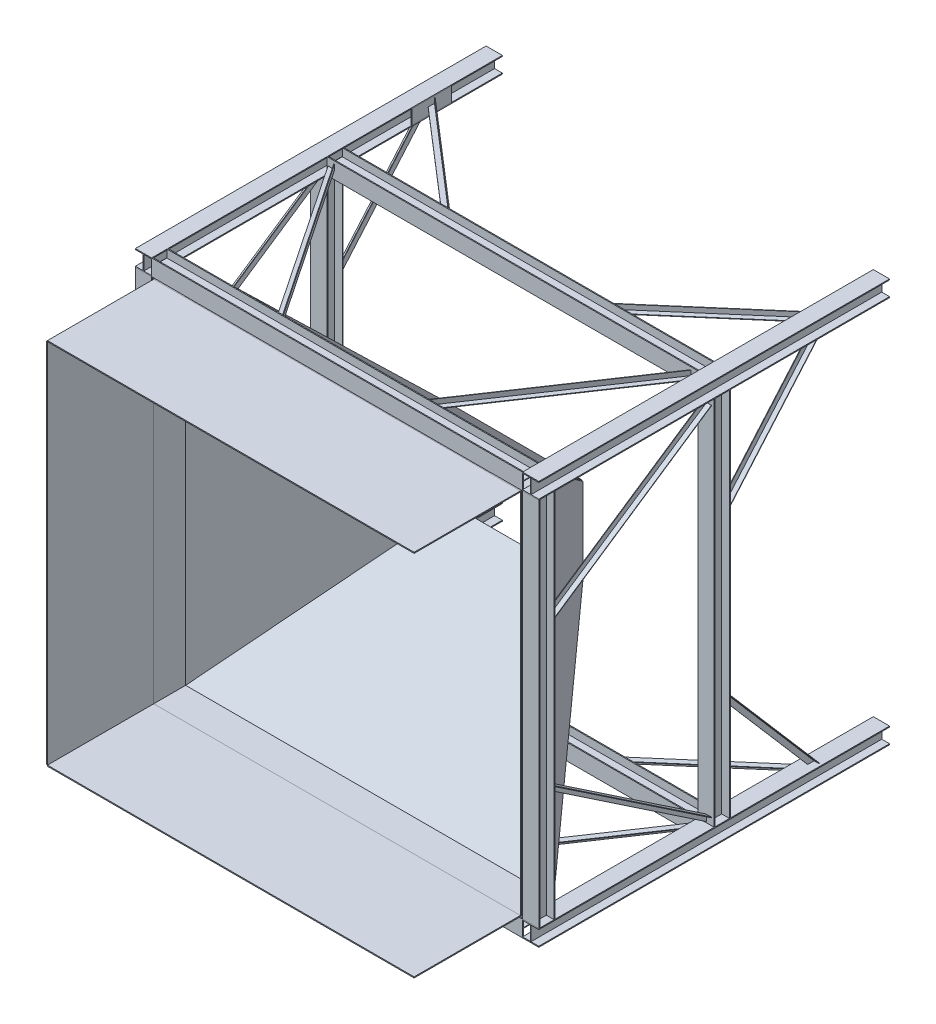
from build123d import *

# Parameters (mm, degrees)
COLUMNA_H_1_DEPTH                            = 3300
COLUMNA_H_2_DEPTH                            = 3300
COLUMNA_H_3_DEPTH                            = 3300
COLUMNA_H_4_DEPTH                            = 3300
VIGA_H_CARGA_1650_DEPTH                      = 3490
VIGA_H_CARGA_3300_DEPTH                      = 3490
CONTORNO_CIERRE_COLUMNA_CARGA_A_W            = 370
CONTORNO_CIERRE_COLUMNA_CARGA_A_H            = 135
CIERRE_COLUMNA_CARGA_A_DEPTH                 = 8
ALA_PLANA_ANGULAR_SUPERIOR_CARGA_A_DEPTH     = 5
RETORNO_ANGULAR_SUPERIOR_CARGA_A_DEPTH       = 45
ALA_PLANA_ANGULAR_INFERIOR_CARGA_A_DEPTH     = 5
RETORNO_ANGULAR_INFERIOR_CARGA_A_DEPTH       = 45
CONTORNO_CIERRE_COLUMNA_CARGA_B_W            = 370
CONTORNO_CIERRE_COLUMNA_CARGA_B_H            = 135
CIERRE_COLUMNA_CARGA_B_DEPTH                 = 8
ALA_PLANA_ANGULAR_SUPERIOR_CARGA_B_DEPTH     = 5
RETORNO_ANGULAR_SUPERIOR_CARGA_B_DEPTH       = 45
ALA_PLANA_ANGULAR_INFERIOR_CARGA_B_DEPTH     = 5
RETORNO_ANGULAR_INFERIOR_CARGA_B_DEPTH       = 45
CONTORNO_ASIENTO_SOLDADO_CARGA_W             = 2900
CONTORNO_ASIENTO_SOLDADO_CARGA_H             = 83.725
ASIENTO_SOLDADO_CARGA_DEPTH                  = 9.525
VIGA_H_FONDO_1650_DEPTH                      = 3490
VIGA_H_FONDO_3300_DEPTH                      = 3490
CONTORNO_CIERRE_COLUMNA_FONDO_A_W            = 370
CONTORNO_CIERRE_COLUMNA_FONDO_A_H            = 135
CIERRE_COLUMNA_FONDO_A_DEPTH                 = 8
ALA_PLANA_ANGULAR_SUPERIOR_FONDO_A_DEPTH     = 5
RETORNO_ANGULAR_SUPERIOR_FONDO_A_DEPTH       = 45
ALA_PLANA_ANGULAR_INFERIOR_FONDO_A_DEPTH     = 5
RETORNO_ANGULAR_INFERIOR_FONDO_A_DEPTH       = 45
CONTORNO_CIERRE_COLUMNA_FONDO_B_W            = 370
CONTORNO_CIERRE_COLUMNA_FONDO_B_H            = 135
CIERRE_COLUMNA_FONDO_B_DEPTH                 = 8
ALA_PLANA_ANGULAR_SUPERIOR_FONDO_B_DEPTH     = 5
RETORNO_ANGULAR_SUPERIOR_FONDO_B_DEPTH       = 45
ALA_PLANA_ANGULAR_INFERIOR_FONDO_B_DEPTH     = 5
RETORNO_ANGULAR_INFERIOR_FONDO_B_DEPTH       = 45
CONTORNO_ASIENTO_SOLDADO_FONDO_W             = 2900
CONTORNO_ASIENTO_SOLDADO_FONDO_H             = 83.725
ASIENTO_SOLDADO_FONDO_DEPTH                  = 9.525
VIGA_H_IZQUIERDA_1650_DEPTH                  = 3490
VIGA_H_IZQUIERDA_3300_DEPTH                  = 3490
ALA_PLANA_ANGULAR_SUPERIOR_IZQUIERDA_A_DEPTH = 5
RETORNO_ANGULAR_SUPERIOR_IZQUIERDA_A_DEPTH   = 45
ALA_PLANA_ANGULAR_INFERIOR_IZQUIERDA_A_DEPTH = 5
RETORNO_ANGULAR_INFERIOR_IZQUIERDA_A_DEPTH   = 45
ALA_PLANA_ANGULAR_SUPERIOR_IZQUIERDA_B_DEPTH = 5
RETORNO_ANGULAR_SUPERIOR_IZQUIERDA_B_DEPTH   = 45
ALA_PLANA_ANGULAR_INFERIOR_IZQUIERDA_B_DEPTH = 5
RETORNO_ANGULAR_INFERIOR_IZQUIERDA_B_DEPTH   = 45
CONTORNO_ASIENTO_SOLDADO_IZQUIERDA_W         = 83.725
CONTORNO_ASIENTO_SOLDADO_IZQUIERDA_H         = 2900
ASIENTO_SOLDADO_IZQUIERDA_DEPTH              = 9.525
VIGA_H_DERECHA_1650_DEPTH                    = 3490
VIGA_H_DERECHA_3300_DEPTH                    = 3490
ALA_PLANA_ANGULAR_SUPERIOR_DERECHA_A_DEPTH   = 5
RETORNO_ANGULAR_SUPERIOR_DERECHA_A_DEPTH     = 45
ALA_PLANA_ANGULAR_INFERIOR_DERECHA_A_DEPTH   = 5
RETORNO_ANGULAR_INFERIOR_DERECHA_A_DEPTH     = 45
ALA_PLANA_ANGULAR_SUPERIOR_DERECHA_B_DEPTH   = 5
RETORNO_ANGULAR_SUPERIOR_DERECHA_B_DEPTH     = 45
ALA_PLANA_ANGULAR_INFERIOR_DERECHA_B_DEPTH   = 5
RETORNO_ANGULAR_INFERIOR_DERECHA_B_DEPTH     = 45
CONTORNO_ASIENTO_SOLDADO_DERECHA_W           = 83.725
CONTORNO_ASIENTO_SOLDADO_DERECHA_H           = 2900
ASIENTO_SOLDADO_DERECHA_DEPTH                = 9.525
CONTORNO_COLLAR_LATERAL_Y_NEGATIVO_W         = 3450
CONTORNO_COLLAR_LATERAL_Y_NEGATIVO_H         = 300
COLLAR_LATERAL_Y_NEGATIVO_DEPTH              = 9.525
CONTORNO_ALER_N_LATERAL_Y_NEGATIVO_W         = 3450
CONTORNO_ALER_N_LATERAL_Y_NEGATIVO_H         = 1000
ALER_N_LATERAL_Y_NEGATIVO_DEPTH              = 9.525
EMBUDO_LATERAL_Y_NEGATIVO_DEPTH              = 9.525
CONTORNO_COLLAR_CARGA_W                      = 300
CONTORNO_COLLAR_CARGA_H                      = 3450
COLLAR_CARGA_DEPTH                           = 9.525
EMBUDO_CARGA_DEPTH                           = 9.525
CONTORNO_COLLAR_LATERAL_Y_POSITIVO_W         = 3450
CONTORNO_COLLAR_LATERAL_Y_POSITIVO_H         = 300
COLLAR_LATERAL_Y_POSITIVO_DEPTH              = 9.525
CONTORNO_ALER_N_LATERAL_Y_POSITIVO_W         = 3450
CONTORNO_ALER_N_LATERAL_Y_POSITIVO_H         = 1000
ALER_N_LATERAL_Y_POSITIVO_DEPTH              = 9.525
EMBUDO_LATERAL_Y_POSITIVO_DEPTH              = 9.525
CONTORNO_COLLAR_FONDO_X_NEGATIVO_W           = 300
CONTORNO_COLLAR_FONDO_X_NEGATIVO_H           = 3450
COLLAR_FONDO_X_NEGATIVO_DEPTH                = 9.525
CONTORNO_ALER_N_FONDO_X_NEGATIVO_W           = 1000
CONTORNO_ALER_N_FONDO_X_NEGATIVO_H           = 3450
ALER_N_FONDO_X_NEGATIVO_DEPTH                = 9.525
EMBUDO_FONDO_X_NEGATIVO_DEPTH                = 9.525


with BuildPart() as part:
    # Contorno Columna H 1 → Columna H 1 (new body)
    with BuildSketch(Plane.XY):
        Polygon((-1898, -1898), (-1745, -1898), (-1745, -1889), (-1818.25, -1889), (-1818.25, -1754), (-1745, -1754), (-1745, -1745), (-1898, -1745), (-1898, -1754), (-1824.75, -1754), (-1824.75, -1889), (-1898, -1889), align=None)
    extrude(amount=COLUMNA_H_1_DEPTH)


with BuildPart() as body_2:
    # Contorno Columna H 2 → Columna H 2 (new body)
    with BuildSketch(Plane.XY):
        Polygon((-1898, 1745), (-1745, 1745), (-1745, 1754), (-1818.25, 1754), (-1818.25, 1889), (-1745, 1889), (-1745, 1898), (-1898, 1898), (-1898, 1889), (-1824.75, 1889), (-1824.75, 1754), (-1898, 1754), align=None)
    extrude(amount=COLUMNA_H_2_DEPTH)


with BuildPart() as body_3:
    # Contorno Columna H 3 → Columna H 3 (new body)
    with BuildSketch(Plane.XY):
        Polygon((1745, -1898), (1898, -1898), (1898, -1889), (1824.75, -1889), (1824.75, -1754), (1898, -1754), (1898, -1745), (1745, -1745), (1745, -1754), (1818.25, -1754), (1818.25, -1889), (1745, -1889), align=None)
    extrude(amount=COLUMNA_H_3_DEPTH)


with BuildPart() as body_4:
    # Contorno Columna H 4 → Columna H 4 (new body)
    with BuildSketch(Plane.XY):
        Polygon((1745, 1745), (1898, 1745), (1898, 1754), (1824.75, 1754), (1824.75, 1889), (1898, 1889), (1898, 1898), (1745, 1898), (1745, 1889), (1818.25, 1889), (1818.25, 1754), (1745, 1754), align=None)
    extrude(amount=COLUMNA_H_4_DEPTH)


with BuildPart() as body_5:
    # Contorno Viga H carga 1650 → Viga H carga 1650 (new body)
    with BuildSketch(Plane(origin=(-1745, 0, 0), x_dir=(0, 0, -1), z_dir=(1, 0, 0))):
        Polygon((-1497, -1745), (-1497, -1898), (-1506, -1898), (-1506, -1824.75), (-1641, -1824.75), (-1641, -1898), (-1650, -1898), (-1650, -1745), (-1641, -1745), (-1641, -1818.25), (-1506, -1818.25), (-1506, -1745), align=None)
    extrude(amount=VIGA_H_CARGA_1650_DEPTH)


with BuildPart() as body_6:
    # Contorno Viga H carga 3300 → Viga H carga 3300 (new body)
    with BuildSketch(Plane(origin=(-1745, 0, 0), x_dir=(0, 0, -1), z_dir=(1, 0, 0))):
        Polygon((-3147, -1745), (-3147, -1898), (-3156, -1898), (-3156, -1824.75), (-3291, -1824.75), (-3291, -1898), (-3300, -1898), (-3300, -1745), (-3291, -1745), (-3291, -1818.25), (-3156, -1818.25), (-3156, -1745), align=None)
    extrude(amount=VIGA_H_CARGA_3300_DEPTH)


with BuildPart() as body_7:
    # Contorno Cierre columna carga A → Cierre columna carga A (new body)
    with BuildSketch(Plane(origin=(-1745, 0, 0), x_dir=(0, 0, -1), z_dir=(1, 0, 0))):
        with Locations((-665, -1821.5)):
            Rectangle(CONTORNO_CIERRE_COLUMNA_CARGA_A_W, CONTORNO_CIERRE_COLUMNA_CARGA_A_H)
    extrude(amount=-CIERRE_COLUMNA_CARGA_A_DEPTH)


with BuildPart() as body_8:
    # Contorno Ala plana Angular superior carg → Ala plana Angular superior carga A (new body)
    with BuildSketch(Plane(origin=(0, -1821.5, 0), x_dir=(1, 0, 0), z_dir=(0, 1, 0))):
        Polygon((-1674.870108064, -1650), (-1735.129891936, -1650), (-728.129891936, -3147), (-667.870108064, -3147), align=None)
    extrude(amount=-ALA_PLANA_ANGULAR_SUPERIOR_CARGA_A_DEPTH)


with BuildPart() as body_9:
    # Contorno Retorno Angular superior carga → Retorno Angular superior carga A (new body)
    with BuildSketch(Plane(origin=(0, -1826.5, 0), x_dir=(1, 0, 0), z_dir=(0, 1, 0))):
        Polygon((-1674.870108064, -1650), (-1680.896086451, -1650), (-673.896086451, -3147), (-667.870108064, -3147), align=None)
    extrude(amount=-RETORNO_ANGULAR_SUPERIOR_CARGA_A_DEPTH)


with BuildPart() as body_8_1:
    add(body_8.part)

    # Angular superior carga A: union body 9
    add(body_9.part)


with BuildPart() as body_9_2:
    # Contorno Ala plana Angular inferior carg → Ala plana Angular inferior carga A (new body)
    with BuildSketch(Plane(origin=(0, -1821.5, 0), x_dir=(1, 0, 0), z_dir=(0, 1, 0))):
        Polygon((-1745, -631.991026401), (-1745, -698.008973599), (-818.285648465, -1497), (-741.714351535, -1497), align=None)
    extrude(amount=-ALA_PLANA_ANGULAR_INFERIOR_CARGA_A_DEPTH)


with BuildPart() as body_10:
    # Contorno Retorno Angular inferior carga → Retorno Angular inferior carga A (new body)
    with BuildSketch(Plane(origin=(0, -1826.5, 0), x_dir=(1, 0, 0), z_dir=(0, 1, 0))):
        Polygon((-1745, -631.991026401), (-1745, -638.592821121), (-749.371481228, -1497), (-741.714351535, -1497), align=None)
    extrude(amount=-RETORNO_ANGULAR_INFERIOR_CARGA_A_DEPTH)


with BuildPart() as body_9_2_1:
    add(body_9_2.part)

    # Angular inferior carga A: union body 10
    add(body_10.part)


with BuildPart() as body_10_2:
    # Contorno Cierre columna carga B → Cierre columna carga B (new body)
    with BuildSketch(Plane(origin=(1745, 0, 0), x_dir=(0, 0, -1), z_dir=(1, 0, 0))):
        with Locations((-665, -1821.5)):
            Rectangle(CONTORNO_CIERRE_COLUMNA_CARGA_B_W, CONTORNO_CIERRE_COLUMNA_CARGA_B_H)
    extrude(amount=CIERRE_COLUMNA_CARGA_B_DEPTH)


with BuildPart() as body_11:
    # Contorno Ala plana Angular superior  2 → Ala plana Angular superior carga B (new body)
    with BuildSketch(Plane(origin=(0, -1821.5, 0), x_dir=(1, 0, 0), z_dir=(0, 1, 0))):
        Polygon((1674.870108064, -1650), (1735.129891936, -1650), (728.129891936, -3147), (667.870108064, -3147), align=None)
    extrude(amount=-ALA_PLANA_ANGULAR_SUPERIOR_CARGA_B_DEPTH)


with BuildPart() as body_12:
    # Contorno Retorno Angular superior ca 2 → Retorno Angular superior carga B (new body)
    with BuildSketch(Plane(origin=(0, -1826.5, 0), x_dir=(1, 0, 0), z_dir=(0, 1, 0))):
        Polygon((1674.870108064, -1650), (1680.896086451, -1650), (673.896086451, -3147), (667.870108064, -3147), align=None)
    extrude(amount=-RETORNO_ANGULAR_SUPERIOR_CARGA_B_DEPTH)


with BuildPart() as body_11_1:
    add(body_11.part)

    # Angular superior carga B: union body 12
    add(body_12.part)


with BuildPart() as body_12_2:
    # Contorno Ala plana Angular inferior  2 → Ala plana Angular inferior carga B (new body)
    with BuildSketch(Plane(origin=(0, -1821.5, 0), x_dir=(1, 0, 0), z_dir=(0, 1, 0))):
        Polygon((1745, -631.991026401), (1745, -698.008973599), (818.285648465, -1497), (741.714351535, -1497), align=None)
    extrude(amount=-ALA_PLANA_ANGULAR_INFERIOR_CARGA_B_DEPTH)


with BuildPart() as body_13:
    # Contorno Retorno Angular inferior ca 2 → Retorno Angular inferior carga B (new body)
    with BuildSketch(Plane(origin=(0, -1826.5, 0), x_dir=(1, 0, 0), z_dir=(0, 1, 0))):
        Polygon((1745, -631.991026401), (1745, -638.592821121), (749.371481228, -1497), (741.714351535, -1497), align=None)
    extrude(amount=-RETORNO_ANGULAR_INFERIOR_CARGA_B_DEPTH)


with BuildPart() as body_12_2_1:
    add(body_12_2.part)

    # Angular inferior carga B: union body 13
    add(body_13.part)


with BuildPart() as body_13_2:
    # Contorno Asiento soldado carga → Asiento soldado carga (new body)
    with BuildSketch(Plane.XY.offset(3281.475)):
        with Locations((0, -1776.3875)):
            Rectangle(CONTORNO_ASIENTO_SOLDADO_CARGA_W, CONTORNO_ASIENTO_SOLDADO_CARGA_H)
    extrude(amount=ASIENTO_SOLDADO_CARGA_DEPTH)


with BuildPart() as body_14:
    # Contorno Viga H fondo 1650 → Viga H fondo 1650 (new body)
    with BuildSketch(Plane(origin=(-1745, 0, 0), x_dir=(0, 0, -1), z_dir=(1, 0, 0))):
        Polygon((-1497, 1745), (-1497, 1898), (-1506, 1898), (-1506, 1824.75), (-1641, 1824.75), (-1641, 1898), (-1650, 1898), (-1650, 1745), (-1641, 1745), (-1641, 1818.25), (-1506, 1818.25), (-1506, 1745), align=None)
    extrude(amount=VIGA_H_FONDO_1650_DEPTH)


with BuildPart() as body_15:
    # Contorno Viga H fondo 3300 → Viga H fondo 3300 (new body)
    with BuildSketch(Plane(origin=(-1745, 0, 0), x_dir=(0, 0, -1), z_dir=(1, 0, 0))):
        Polygon((-3147, 1745), (-3147, 1898), (-3156, 1898), (-3156, 1824.75), (-3291, 1824.75), (-3291, 1898), (-3300, 1898), (-3300, 1745), (-3291, 1745), (-3291, 1818.25), (-3156, 1818.25), (-3156, 1745), align=None)
    extrude(amount=VIGA_H_FONDO_3300_DEPTH)


with BuildPart() as body_16:
    # Contorno Cierre columna fondo A → Cierre columna fondo A (new body)
    with BuildSketch(Plane(origin=(-1745, 0, 0), x_dir=(0, 0, -1), z_dir=(1, 0, 0))):
        with Locations((-665, 1821.5)):
            Rectangle(CONTORNO_CIERRE_COLUMNA_FONDO_A_W, CONTORNO_CIERRE_COLUMNA_FONDO_A_H)
    extrude(amount=-CIERRE_COLUMNA_FONDO_A_DEPTH)


with BuildPart() as body_17:
    # Contorno Ala plana Angular superior fond → Ala plana Angular superior fondo A (new body)
    with BuildSketch(Plane(origin=(0, 1821.5, 0), x_dir=(1, 0, 0), z_dir=(0, 1, 0))):
        Polygon((-1674.870108064, -1650), (-1735.129891936, -1650), (-728.129891936, -3147), (-667.870108064, -3147), align=None)
    extrude(amount=ALA_PLANA_ANGULAR_SUPERIOR_FONDO_A_DEPTH)


with BuildPart() as body_18:
    # Contorno Retorno Angular superior fondo → Retorno Angular superior fondo A (new body)
    with BuildSketch(Plane(origin=(0, 1826.5, 0), x_dir=(1, 0, 0), z_dir=(0, 1, 0))):
        Polygon((-1674.870108064, -1650), (-1680.896086451, -1650), (-673.896086451, -3147), (-667.870108064, -3147), align=None)
    extrude(amount=RETORNO_ANGULAR_SUPERIOR_FONDO_A_DEPTH)


with BuildPart() as body_17_1:
    add(body_17.part)

    # Angular superior fondo A: union body 18
    add(body_18.part)


with BuildPart() as body_18_2:
    # Contorno Ala plana Angular inferior fond → Ala plana Angular inferior fondo A (new body)
    with BuildSketch(Plane(origin=(0, 1821.5, 0), x_dir=(1, 0, 0), z_dir=(0, 1, 0))):
        Polygon((-1745, -631.991026401), (-1745, -698.008973599), (-818.285648465, -1497), (-741.714351535, -1497), align=None)
    extrude(amount=ALA_PLANA_ANGULAR_INFERIOR_FONDO_A_DEPTH)


with BuildPart() as body_19:
    # Contorno Retorno Angular inferior fondo → Retorno Angular inferior fondo A (new body)
    with BuildSketch(Plane(origin=(0, 1826.5, 0), x_dir=(1, 0, 0), z_dir=(0, 1, 0))):
        Polygon((-1745, -631.991026401), (-1745, -638.592821121), (-749.371481228, -1497), (-741.714351535, -1497), align=None)
    extrude(amount=RETORNO_ANGULAR_INFERIOR_FONDO_A_DEPTH)


with BuildPart() as body_18_2_1:
    add(body_18_2.part)

    # Angular inferior fondo A: union body 19
    add(body_19.part)


with BuildPart() as body_19_2:
    # Contorno Cierre columna fondo B → Cierre columna fondo B (new body)
    with BuildSketch(Plane(origin=(1745, 0, 0), x_dir=(0, 0, -1), z_dir=(1, 0, 0))):
        with Locations((-665, 1821.5)):
            Rectangle(CONTORNO_CIERRE_COLUMNA_FONDO_B_W, CONTORNO_CIERRE_COLUMNA_FONDO_B_H)
    extrude(amount=CIERRE_COLUMNA_FONDO_B_DEPTH)


with BuildPart() as body_20:
    # Contorno Ala plana Angular superior  3 → Ala plana Angular superior fondo B (new body)
    with BuildSketch(Plane(origin=(0, 1821.5, 0), x_dir=(1, 0, 0), z_dir=(0, 1, 0))):
        Polygon((1674.870108064, -1650), (1735.129891936, -1650), (728.129891936, -3147), (667.870108064, -3147), align=None)
    extrude(amount=ALA_PLANA_ANGULAR_SUPERIOR_FONDO_B_DEPTH)


with BuildPart() as body_21:
    # Contorno Retorno Angular superior fo 2 → Retorno Angular superior fondo B (new body)
    with BuildSketch(Plane(origin=(0, 1826.5, 0), x_dir=(1, 0, 0), z_dir=(0, 1, 0))):
        Polygon((1674.870108064, -1650), (1680.896086451, -1650), (673.896086451, -3147), (667.870108064, -3147), align=None)
    extrude(amount=RETORNO_ANGULAR_SUPERIOR_FONDO_B_DEPTH)


with BuildPart() as body_20_1:
    add(body_20.part)

    # Angular superior fondo B: union body 21
    add(body_21.part)


with BuildPart() as body_21_2:
    # Contorno Ala plana Angular inferior  3 → Ala plana Angular inferior fondo B (new body)
    with BuildSketch(Plane(origin=(0, 1821.5, 0), x_dir=(1, 0, 0), z_dir=(0, 1, 0))):
        Polygon((1745, -631.991026401), (1745, -698.008973599), (818.285648465, -1497), (741.714351535, -1497), align=None)
    extrude(amount=ALA_PLANA_ANGULAR_INFERIOR_FONDO_B_DEPTH)


with BuildPart() as body_22:
    # Contorno Retorno Angular inferior fo 2 → Retorno Angular inferior fondo B (new body)
    with BuildSketch(Plane(origin=(0, 1826.5, 0), x_dir=(1, 0, 0), z_dir=(0, 1, 0))):
        Polygon((1745, -631.991026401), (1745, -638.592821121), (749.371481228, -1497), (741.714351535, -1497), align=None)
    extrude(amount=RETORNO_ANGULAR_INFERIOR_FONDO_B_DEPTH)


with BuildPart() as body_21_2_1:
    add(body_21_2.part)

    # Angular inferior fondo B: union body 22
    add(body_22.part)


with BuildPart() as body_22_2:
    # Contorno Asiento soldado fondo → Asiento soldado fondo (new body)
    with BuildSketch(Plane.XY.offset(3281.475)):
        with Locations((0, 1776.3875)):
            Rectangle(CONTORNO_ASIENTO_SOLDADO_FONDO_W, CONTORNO_ASIENTO_SOLDADO_FONDO_H)
    extrude(amount=ASIENTO_SOLDADO_FONDO_DEPTH)


with BuildPart() as body_23:
    # Contorno Viga H izquierda 1650 → Viga H izquierda 1650 (new body)
    with BuildSketch(Plane(origin=(0, -1745, 0), x_dir=(1, 0, 0), z_dir=(0, 1, 0))):
        Polygon((-1745, -1497), (-1898, -1497), (-1898, -1506), (-1824.75, -1506), (-1824.75, -1641), (-1898, -1641), (-1898, -1650), (-1745, -1650), (-1745, -1641), (-1818.25, -1641), (-1818.25, -1506), (-1745, -1506), align=None)
    extrude(amount=VIGA_H_IZQUIERDA_1650_DEPTH)


with BuildPart() as body_24:
    # Contorno Viga H izquierda 3300 → Viga H izquierda 3300 (new body)
    with BuildSketch(Plane(origin=(0, -1745, 0), x_dir=(1, 0, 0), z_dir=(0, 1, 0))):
        Polygon((-1745, -3147), (-1898, -3147), (-1898, -3156), (-1824.75, -3156), (-1824.75, -3291), (-1898, -3291), (-1898, -3300), (-1745, -3300), (-1745, -3291), (-1818.25, -3291), (-1818.25, -3156), (-1745, -3156), align=None)
    extrude(amount=VIGA_H_IZQUIERDA_3300_DEPTH)


with BuildPart() as body_25:
    # Contorno Ala plana Angular superior izqu → Ala plana Angular superior izquierda A (new body)
    with BuildSketch(Plane(origin=(-1821.5, 0, 0), x_dir=(0, 0, -1), z_dir=(1, 0, 0))):
        Polygon((-1650, -1674.870108064), (-1650, -1735.129891936), (-3147, -728.129891936), (-3147, -667.870108064), align=None)
    extrude(amount=-ALA_PLANA_ANGULAR_SUPERIOR_IZQUIERDA_A_DEPTH)


with BuildPart() as body_26:
    # Contorno Retorno Angular superior izquie → Retorno Angular superior izquierda A (new body)
    with BuildSketch(Plane(origin=(-1826.5, 0, 0), x_dir=(0, 0, -1), z_dir=(1, 0, 0))):
        Polygon((-1650, -1674.870108064), (-1650, -1680.896086451), (-3147, -673.896086451), (-3147, -667.870108064), align=None)
    extrude(amount=-RETORNO_ANGULAR_SUPERIOR_IZQUIERDA_A_DEPTH)


with BuildPart() as body_25_1:
    add(body_25.part)

    # Angular superior izquierda A: union body 26
    add(body_26.part)


with BuildPart() as body_26_2:
    # Contorno Ala plana Angular inferior izqu → Ala plana Angular inferior izquierda A (new body)
    with BuildSketch(Plane(origin=(-1821.5, 0, 0), x_dir=(0, 0, -1), z_dir=(1, 0, 0))):
        Polygon((-631.991026401, -1745), (-698.008973599, -1745), (-1497, -818.285648465), (-1497, -741.714351535), align=None)
    extrude(amount=-ALA_PLANA_ANGULAR_INFERIOR_IZQUIERDA_A_DEPTH)


with BuildPart() as body_27:
    # Contorno Retorno Angular inferior izquie → Retorno Angular inferior izquierda A (new body)
    with BuildSketch(Plane(origin=(-1826.5, 0, 0), x_dir=(0, 0, -1), z_dir=(1, 0, 0))):
        Polygon((-631.991026401, -1745), (-638.592821121, -1745), (-1497, -749.371481228), (-1497, -741.714351535), align=None)
    extrude(amount=-RETORNO_ANGULAR_INFERIOR_IZQUIERDA_A_DEPTH)


with BuildPart() as body_26_2_1:
    add(body_26_2.part)

    # Angular inferior izquierda A: union body 27
    add(body_27.part)


with BuildPart() as body_27_2:
    # Contorno Ala plana Angular superior  4 → Ala plana Angular superior izquierda B (new body)
    with BuildSketch(Plane(origin=(-1821.5, 0, 0), x_dir=(0, 0, -1), z_dir=(1, 0, 0))):
        Polygon((-1650, 1674.870108064), (-1650, 1735.129891936), (-3147, 728.129891936), (-3147, 667.870108064), align=None)
    extrude(amount=-ALA_PLANA_ANGULAR_SUPERIOR_IZQUIERDA_B_DEPTH)


with BuildPart() as body_28:
    # Contorno Retorno Angular superior iz 2 → Retorno Angular superior izquierda B (new body)
    with BuildSketch(Plane(origin=(-1826.5, 0, 0), x_dir=(0, 0, -1), z_dir=(1, 0, 0))):
        Polygon((-1650, 1674.870108064), (-1650, 1680.896086451), (-3147, 673.896086451), (-3147, 667.870108064), align=None)
    extrude(amount=-RETORNO_ANGULAR_SUPERIOR_IZQUIERDA_B_DEPTH)


with BuildPart() as body_27_2_1:
    add(body_27_2.part)

    # Angular superior izquierda B: union body 28
    add(body_28.part)


with BuildPart() as body_28_2:
    # Contorno Ala plana Angular inferior  4 → Ala plana Angular inferior izquierda B (new body)
    with BuildSketch(Plane(origin=(-1821.5, 0, 0), x_dir=(0, 0, -1), z_dir=(1, 0, 0))):
        Polygon((-631.991026401, 1745), (-698.008973599, 1745), (-1497, 818.285648465), (-1497, 741.714351535), align=None)
    extrude(amount=-ALA_PLANA_ANGULAR_INFERIOR_IZQUIERDA_B_DEPTH)


with BuildPart() as body_29:
    # Contorno Retorno Angular inferior iz 2 → Retorno Angular inferior izquierda B (new body)
    with BuildSketch(Plane(origin=(-1826.5, 0, 0), x_dir=(0, 0, -1), z_dir=(1, 0, 0))):
        Polygon((-631.991026401, 1745), (-638.592821121, 1745), (-1497, 749.371481228), (-1497, 741.714351535), align=None)
    extrude(amount=-RETORNO_ANGULAR_INFERIOR_IZQUIERDA_B_DEPTH)


with BuildPart() as body_28_2_1:
    add(body_28_2.part)

    # Angular inferior izquierda B: union body 29
    add(body_29.part)


with BuildPart() as body_29_2:
    # Contorno Asiento soldado izquierda → Asiento soldado izquierda (new body)
    with BuildSketch(Plane.XY.offset(3281.475)):
        with Locations((-1776.3875, 0)):
            Rectangle(CONTORNO_ASIENTO_SOLDADO_IZQUIERDA_W, CONTORNO_ASIENTO_SOLDADO_IZQUIERDA_H)
    extrude(amount=ASIENTO_SOLDADO_IZQUIERDA_DEPTH)


with BuildPart() as body_30:
    # Contorno Viga H derecha 1650 → Viga H derecha 1650 (new body)
    with BuildSketch(Plane(origin=(0, -1745, 0), x_dir=(1, 0, 0), z_dir=(0, 1, 0))):
        Polygon((1745, -1497), (1898, -1497), (1898, -1506), (1824.75, -1506), (1824.75, -1641), (1898, -1641), (1898, -1650), (1745, -1650), (1745, -1641), (1818.25, -1641), (1818.25, -1506), (1745, -1506), align=None)
    extrude(amount=VIGA_H_DERECHA_1650_DEPTH)


with BuildPart() as body_31:
    # Contorno Viga H derecha 3300 → Viga H derecha 3300 (new body)
    with BuildSketch(Plane(origin=(0, -1745, 0), x_dir=(1, 0, 0), z_dir=(0, 1, 0))):
        Polygon((1745, -3147), (1898, -3147), (1898, -3156), (1824.75, -3156), (1824.75, -3291), (1898, -3291), (1898, -3300), (1745, -3300), (1745, -3291), (1818.25, -3291), (1818.25, -3156), (1745, -3156), align=None)
    extrude(amount=VIGA_H_DERECHA_3300_DEPTH)


with BuildPart() as body_32:
    # Contorno Ala plana Angular superior dere → Ala plana Angular superior derecha A (new body)
    with BuildSketch(Plane(origin=(1821.5, 0, 0), x_dir=(0, 0, -1), z_dir=(1, 0, 0))):
        Polygon((-1650, -1674.870108064), (-1650, -1735.129891936), (-3147, -728.129891936), (-3147, -667.870108064), align=None)
    extrude(amount=ALA_PLANA_ANGULAR_SUPERIOR_DERECHA_A_DEPTH)


with BuildPart() as body_33:
    # Contorno Retorno Angular superior derech → Retorno Angular superior derecha A (new body)
    with BuildSketch(Plane(origin=(1826.5, 0, 0), x_dir=(0, 0, -1), z_dir=(1, 0, 0))):
        Polygon((-1650, -1674.870108064), (-1650, -1680.896086451), (-3147, -673.896086451), (-3147, -667.870108064), align=None)
    extrude(amount=RETORNO_ANGULAR_SUPERIOR_DERECHA_A_DEPTH)


with BuildPart() as body_32_1:
    add(body_32.part)

    # Angular superior derecha A: union body 33
    add(body_33.part)


with BuildPart() as body_33_2:
    # Contorno Ala plana Angular inferior dere → Ala plana Angular inferior derecha A (new body)
    with BuildSketch(Plane(origin=(1821.5, 0, 0), x_dir=(0, 0, -1), z_dir=(1, 0, 0))):
        Polygon((-631.991026401, -1745), (-698.008973599, -1745), (-1497, -818.285648465), (-1497, -741.714351535), align=None)
    extrude(amount=ALA_PLANA_ANGULAR_INFERIOR_DERECHA_A_DEPTH)


with BuildPart() as body_34:
    # Contorno Retorno Angular inferior derech → Retorno Angular inferior derecha A (new body)
    with BuildSketch(Plane(origin=(1826.5, 0, 0), x_dir=(0, 0, -1), z_dir=(1, 0, 0))):
        Polygon((-631.991026401, -1745), (-638.592821121, -1745), (-1497, -749.371481228), (-1497, -741.714351535), align=None)
    extrude(amount=RETORNO_ANGULAR_INFERIOR_DERECHA_A_DEPTH)


with BuildPart() as body_33_2_1:
    add(body_33_2.part)

    # Angular inferior derecha A: union body 34
    add(body_34.part)


with BuildPart() as body_34_2:
    # Contorno Ala plana Angular superior  5 → Ala plana Angular superior derecha B (new body)
    with BuildSketch(Plane(origin=(1821.5, 0, 0), x_dir=(0, 0, -1), z_dir=(1, 0, 0))):
        Polygon((-1650, 1674.870108064), (-1650, 1735.129891936), (-3147, 728.129891936), (-3147, 667.870108064), align=None)
    extrude(amount=ALA_PLANA_ANGULAR_SUPERIOR_DERECHA_B_DEPTH)


with BuildPart() as body_35:
    # Contorno Retorno Angular superior de 2 → Retorno Angular superior derecha B (new body)
    with BuildSketch(Plane(origin=(1826.5, 0, 0), x_dir=(0, 0, -1), z_dir=(1, 0, 0))):
        Polygon((-1650, 1674.870108064), (-1650, 1680.896086451), (-3147, 673.896086451), (-3147, 667.870108064), align=None)
    extrude(amount=RETORNO_ANGULAR_SUPERIOR_DERECHA_B_DEPTH)


with BuildPart() as body_34_2_1:
    add(body_34_2.part)

    # Angular superior derecha B: union body 35
    add(body_35.part)


with BuildPart() as body_35_2:
    # Contorno Ala plana Angular inferior  5 → Ala plana Angular inferior derecha B (new body)
    with BuildSketch(Plane(origin=(1821.5, 0, 0), x_dir=(0, 0, -1), z_dir=(1, 0, 0))):
        Polygon((-631.991026401, 1745), (-698.008973599, 1745), (-1497, 818.285648465), (-1497, 741.714351535), align=None)
    extrude(amount=ALA_PLANA_ANGULAR_INFERIOR_DERECHA_B_DEPTH)


with BuildPart() as body_36:
    # Contorno Retorno Angular inferior de 2 → Retorno Angular inferior derecha B (new body)
    with BuildSketch(Plane(origin=(1826.5, 0, 0), x_dir=(0, 0, -1), z_dir=(1, 0, 0))):
        Polygon((-631.991026401, 1745), (-638.592821121, 1745), (-1497, 749.371481228), (-1497, 741.714351535), align=None)
    extrude(amount=RETORNO_ANGULAR_INFERIOR_DERECHA_B_DEPTH)


with BuildPart() as body_35_2_1:
    add(body_35_2.part)

    # Angular inferior derecha B: union body 36
    add(body_36.part)


with BuildPart() as body_36_2:
    # Contorno Asiento soldado derecha → Asiento soldado derecha (new body)
    with BuildSketch(Plane.XY.offset(3281.475)):
        with Locations((1776.3875, 0)):
            Rectangle(CONTORNO_ASIENTO_SOLDADO_DERECHA_W, CONTORNO_ASIENTO_SOLDADO_DERECHA_H)
    extrude(amount=ASIENTO_SOLDADO_DERECHA_DEPTH)


with BuildPart() as body_37:
    # Contorno Collar lateral Y negativo → Collar lateral Y negativo (new body)
    with BuildSketch(Plane(origin=(0, -1725, 0), x_dir=(1, 0, 0), z_dir=(0, 1, 0))):
        with Locations((0, -3150)):
            Rectangle(CONTORNO_COLLAR_LATERAL_Y_NEGATIVO_W, CONTORNO_COLLAR_LATERAL_Y_NEGATIVO_H)
    extrude(amount=-COLLAR_LATERAL_Y_NEGATIVO_DEPTH)


with BuildPart() as body_38:
    # Contorno Alerón lateral Y negativo → Alerón lateral Y negativo (new body)
    with BuildSketch(Plane(origin=(0, -1725, 0), x_dir=(1, 0, 0), z_dir=(0, 1, 0))):
        with Locations((0, -3800)):
            Rectangle(CONTORNO_ALER_N_LATERAL_Y_NEGATIVO_W, CONTORNO_ALER_N_LATERAL_Y_NEGATIVO_H)
    extrude(amount=-ALER_N_LATERAL_Y_NEGATIVO_DEPTH)


with BuildPart() as body_39:
    # Contorno Embudo lateral Y negativo → Embudo lateral Y negativo (new body)
    with BuildSketch(Plane(origin=(0, 587.788057191, 556.29941127), x_dir=(1, 0, 0), z_dir=(0, 0.726293399809769, 0.68738482481996))):
        Polygon((-1725, -3364.619022244), (1725, -3364.619022244), (600, -1437.023369624), (-600, -1437.023369624), align=None)
    extrude(amount=-EMBUDO_LATERAL_Y_NEGATIVO_DEPTH)


with BuildPart() as body_40:
    # Contorno Collar carga → Collar carga (new body)
    with BuildSketch(Plane(origin=(1725, 0, 0), x_dir=(0, 0, -1), z_dir=(1, 0, 0))):
        with Locations((-3150, 0)):
            Rectangle(CONTORNO_COLLAR_CARGA_W, CONTORNO_COLLAR_CARGA_H)
    extrude(amount=COLLAR_CARGA_DEPTH)


with BuildPart() as body_41:
    # Contorno Embudo carga → Embudo carga (new body)
    with BuildSketch(Plane(origin=(-416.663437318, 0, 334.818833559), x_dir=(-0.6263911083160484, 0, -0.7795089347933049), z_dir=(0.7795089347933047, 0, -0.6263911083160483))):
        Polygon((-3419.051466225, -1725), (-3419.051466225, 1725), (-1623.048960659, 400), (-1623.048960659, -400), align=None)
    extrude(amount=EMBUDO_CARGA_DEPTH)


with BuildPart() as body_42:
    # Contorno Collar lateral Y positivo → Collar lateral Y positivo (new body)
    with BuildSketch(Plane(origin=(0, 1725, 0), x_dir=(1, 0, 0), z_dir=(0, 1, 0))):
        with Locations((0, -3150)):
            Rectangle(CONTORNO_COLLAR_LATERAL_Y_POSITIVO_W, CONTORNO_COLLAR_LATERAL_Y_POSITIVO_H)
    extrude(amount=COLLAR_LATERAL_Y_POSITIVO_DEPTH)


with BuildPart() as body_43:
    # Contorno Alerón lateral Y positivo → Alerón lateral Y positivo (new body)
    with BuildSketch(Plane(origin=(0, 1725, 0), x_dir=(1, 0, 0), z_dir=(0, 1, 0))):
        with Locations((0, -3800)):
            Rectangle(CONTORNO_ALER_N_LATERAL_Y_POSITIVO_W, CONTORNO_ALER_N_LATERAL_Y_POSITIVO_H)
    extrude(amount=ALER_N_LATERAL_Y_POSITIVO_DEPTH)


with BuildPart() as body_44:
    # Contorno Embudo lateral Y positivo → Embudo lateral Y positivo (new body)
    with BuildSketch(Plane(origin=(0, -587.788057191, 556.29941127), x_dir=(1, 0, 0), z_dir=(0, 0.726293399809769, -0.68738482481996))):
        Polygon((1725, -3364.619022244), (-1725, -3364.619022244), (-600, -1437.023369624), (600, -1437.023369624), align=None)
    extrude(amount=EMBUDO_LATERAL_Y_POSITIVO_DEPTH)


with BuildPart() as body_45:
    # Contorno Collar fondo X negativo → Collar fondo X negativo (new body)
    with BuildSketch(Plane(origin=(-1725, 0, 0), x_dir=(0, 0, -1), z_dir=(1, 0, 0))):
        with Locations((-3150, 0)):
            Rectangle(CONTORNO_COLLAR_FONDO_X_NEGATIVO_W, CONTORNO_COLLAR_FONDO_X_NEGATIVO_H)
    extrude(amount=-COLLAR_FONDO_X_NEGATIVO_DEPTH)


with BuildPart() as body_46:
    # Contorno Alerón fondo X negativo → Alerón fondo X negativo (new body)
    with BuildSketch(Plane(origin=(-1725, 0, 0), x_dir=(0, 0, -1), z_dir=(1, 0, 0))):
        with Locations((-3800, 0)):
            Rectangle(CONTORNO_ALER_N_FONDO_X_NEGATIVO_W, CONTORNO_ALER_N_FONDO_X_NEGATIVO_H)
    extrude(amount=-ALER_N_FONDO_X_NEGATIVO_DEPTH)


with BuildPart() as body_47:
    # Contorno Embudo fondo X negativo → Embudo fondo X negativo (new body)
    with BuildSketch(Plane(origin=(416.663437318, 0, 334.818833559), x_dir=(0.6263911083160484, 0, -0.7795089347933049), z_dir=(0.7795089347933047, 0, 0.6263911083160483))):
        Polygon((-3419.051466225, 1725), (-3419.051466225, -1725), (-1623.048960659, -400), (-1623.048960659, 400), align=None)
    extrude(amount=-EMBUDO_FONDO_X_NEGATIVO_DEPTH)


solid = Compound([part.part, body_2.part, body_3.part, body_4.part, body_5.part, body_6.part, body_7.part, body_8_1.part, body_9_2_1.part, body_10_2.part, body_11_1.part, body_12_2_1.part, body_13_2.part, body_14.part, body_15.part, body_16.part, body_17_1.part, body_18_2_1.part, body_19_2.part, body_20_1.part, body_21_2_1.part, body_22_2.part, body_23.part, body_24.part, body_25_1.part, body_26_2_1.part, body_27_2_1.part, body_28_2_1.part, body_29_2.part, body_30.part, body_31.part, body_32_1.part, body_33_2_1.part, body_34_2_1.part, body_35_2_1.part, body_36_2.part, body_37.part, body_38.part, body_39.part, body_40.part, body_41.part, body_42.part, body_43.part, body_44.part, body_45.part, body_46.part, body_47.part])
